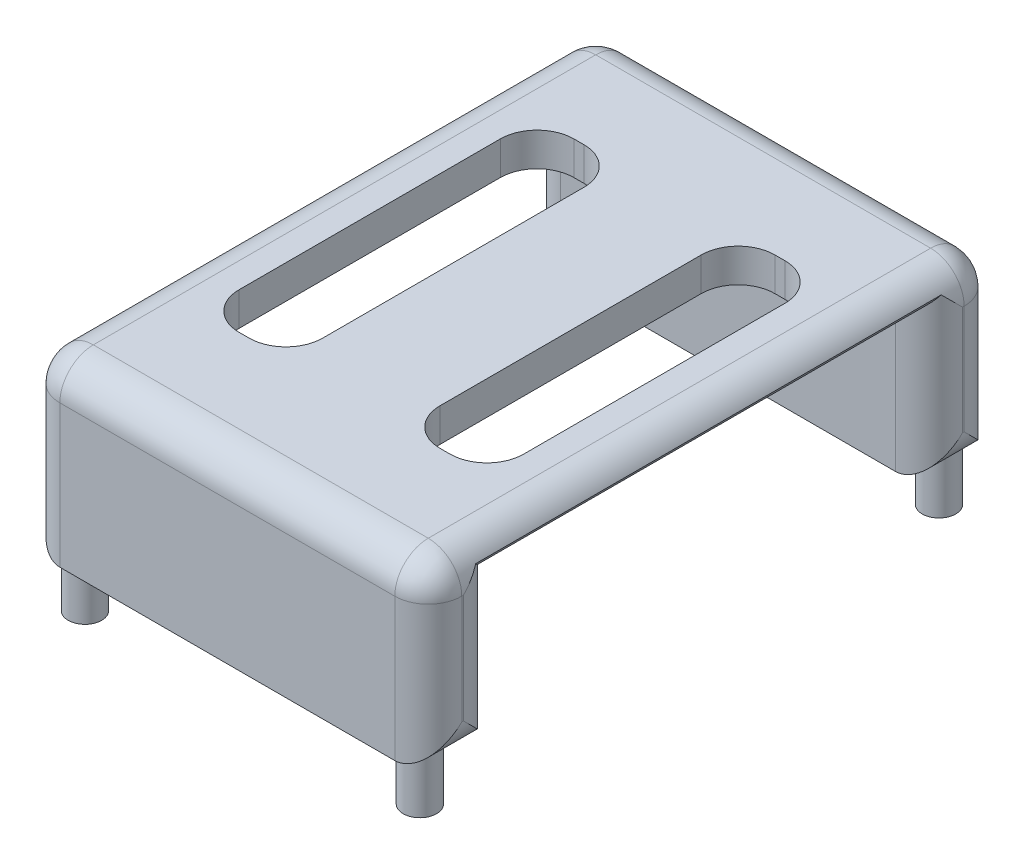
from build123d import *

# Parameters (mm, degrees)
SKETCH_1_W          = 20
SKETCH_1_H          = 2.6
EXTRUDE_1_DEPTH     = 8.5
SKETCH_2_W          = 24
SKETCH_2_H          = 34
EXTRUDE_2_DEPTH     = 2
FILLET_1_R          = 2
SKETCH_3_R          = 1
EXTRUDE_3_DEPTH     = 3
FILLET_2_R          = 2
CUT_EXTRUDE_1_DEPTH = 3


with BuildPart() as part:
    # 草图1 → 凸台-拉伸1 (new body)
    with BuildSketch(Plane(origin=(0, 0, 0), x_dir=(1, 0, 0), z_dir=(0, 1, 0))):
        Polygon((-10, -12.9), (-12, -12.9), (-12, -17), (12, -17), (12, -12.9), (10, -12.9), (10, -15.5), (-10, -15.5), align=None)
        with Locations((0, -14.2)):
            Rectangle(SKETCH_1_W, SKETCH_1_H)
        with Locations((0, 14.2)):
            Rectangle(SKETCH_1_W, SKETCH_1_H)
        Polygon((-12, 17), (-12, 12.9), (-10, 12.9), (-10, 15.5), (10, 15.5), (10, 12.9), (12, 12.9), (12, 17), align=None)
    extrude(amount=EXTRUDE_1_DEPTH)

    # 草图2 → 凸台-拉伸2 (add)
    with BuildSketch(Plane(origin=(0, 8.5, 0), x_dir=(1, 0, 0), z_dir=(0, 1, 0))):
        Rectangle(SKETCH_2_W, SKETCH_2_H)
    extrude(amount=EXTRUDE_2_DEPTH)

    # 圆角1
    fillet_1_edges = [part.edges().sort_by_distance(p)[0] for p in [
        (0, 10.5, -17),
        (0, 10.5, 17),
    ]]
    fillet(fillet_1_edges, radius=FILLET_1_R)

    # 草图3 → 凸台-拉伸3 (add)
    with BuildSketch(Plane(origin=(0, 0, 0), x_dir=(-1, 0, 0), z_dir=(0, -1, 0))):
        with Locations(Location((-10, -15.5, 0), (0, 0, 270))):
            Circle(SKETCH_3_R)
        with Locations(Location((10, -15.5, 0), (0, 0, 270))):
            Circle(SKETCH_3_R)
        with Locations(Location((-10, 15.5, 0), (0, 0, 270))):
            Circle(SKETCH_3_R)
        with Locations(Location((10, 15.5, 0), (0, 0, 270))):
            Circle(SKETCH_3_R)
    extrude(amount=EXTRUDE_3_DEPTH)

    # 圆角2
    # the kernel refuses this fillet: 2 mm, written as the material it takes off along each edge
    with BuildSketch(Plane(origin=(12, 0, -12.9), x_dir=(0, 1, 0), z_dir=(0, 0, -1))) as fillet_2_piece_1_section:
        with BuildLine():
            CenterArc((FILLET_2_R, -FILLET_2_R), FILLET_2_R, 90, 90)
            Line((0, -FILLET_2_R), (-FILLET_2_R * 0.02, -FILLET_2_R))
            Line((-FILLET_2_R * 0.02, -FILLET_2_R), (-FILLET_2_R * 0.02, FILLET_2_R * 0.02))
            Line((-FILLET_2_R * 0.02, FILLET_2_R * 0.02), (FILLET_2_R, FILLET_2_R * 0.02))
            Line((FILLET_2_R, FILLET_2_R * 0.02), (FILLET_2_R, 0))
        make_face()
    fillet_2_piece_1 = extrude(amount=4.1, mode=Mode.PRIVATE)
    fillet_2_piece_1 = fillet_2_piece_1 - Plane(origin=(10, 0.469962564, -15.5), x_dir=(0, 0, 1), z_dir=(0, 1, 0)) * Cylinder(1, 17, mode=Mode.PRIVATE)
    add(fillet_2_piece_1, mode=Mode.SUBTRACT)
    with BuildSketch(Plane(origin=(12, 0, -12.9), x_dir=(0, 0, -1), z_dir=(0, 1, 0)), Plane(origin=(-12, 0, 17), x_dir=(1, 0, 0), z_dir=(0, 1, 0)), Plane(origin=(-12, 0, -12.9), x_dir=(1, 0, 0), z_dir=(0, 1, 0)), Plane(origin=(-12, 8.5, -17), x_dir=(1, 0, 0), z_dir=(0, -1, 0))) as fillet_2_piece_2:
        with BuildLine():
            CenterArc((FILLET_2_R, FILLET_2_R), FILLET_2_R, 180, 90)
            Line((0, FILLET_2_R), (-FILLET_2_R * 0.02, FILLET_2_R))
            Line((-FILLET_2_R * 0.02, FILLET_2_R), (-FILLET_2_R * 0.02, -FILLET_2_R * 0.02))
            Line((-FILLET_2_R * 0.02, -FILLET_2_R * 0.02), (FILLET_2_R, -FILLET_2_R * 0.02))
            Line((FILLET_2_R, -FILLET_2_R * 0.02), (FILLET_2_R, 0))
        make_face()
    extrude(amount=8.5, mode=Mode.SUBTRACT)
    with BuildSketch(Plane(origin=(12, 8.5, -12.9), x_dir=(0, 1, 0), z_dir=(0, 0, 1))) as fillet_2_piece_3:
        with BuildLine():
            CenterArc((FILLET_2_R, FILLET_2_R), FILLET_2_R, 180, 90)
            Line((0, FILLET_2_R), (-FILLET_2_R * 0.02, FILLET_2_R))
            Line((-FILLET_2_R * 0.02, FILLET_2_R), (-FILLET_2_R * 0.02, -FILLET_2_R * 0.02))
            Line((-FILLET_2_R * 0.02, -FILLET_2_R * 0.02), (FILLET_2_R, -FILLET_2_R * 0.02))
            Line((FILLET_2_R, -FILLET_2_R * 0.02), (FILLET_2_R, 0))
        make_face()
    extrude(amount=25.8, mode=Mode.SUBTRACT)
    with BuildSketch(Plane(origin=(12, 0, 12.9), x_dir=(0, 0, 1), z_dir=(0, 1, 0)), Plane(origin=(12, 8.5, 17), x_dir=(0, 0, -1), z_dir=(0, -1, 0)), Plane(origin=(12, 0, -17), x_dir=(0, 0, 1), z_dir=(0, 1, 0)), Plane(origin=(-12, 0, 12.9), x_dir=(1, 0, 0), z_dir=(0, 1, 0))) as fillet_2_piece_4:
        with BuildLine():
            CenterArc((FILLET_2_R, -FILLET_2_R), FILLET_2_R, 90, 90)
            Line((0, -FILLET_2_R), (-FILLET_2_R * 0.02, -FILLET_2_R))
            Line((-FILLET_2_R * 0.02, -FILLET_2_R), (-FILLET_2_R * 0.02, FILLET_2_R * 0.02))
            Line((-FILLET_2_R * 0.02, FILLET_2_R * 0.02), (FILLET_2_R, FILLET_2_R * 0.02))
            Line((FILLET_2_R, FILLET_2_R * 0.02), (FILLET_2_R, 0))
        make_face()
    extrude(amount=8.5, mode=Mode.SUBTRACT)
    with BuildSketch(Plane(origin=(12, 0, 17), x_dir=(0, 1, 0), z_dir=(0, 0, -1))) as fillet_2_piece_5_section:
        with BuildLine():
            CenterArc((FILLET_2_R, -FILLET_2_R), FILLET_2_R, 90, 90)
            Line((0, -FILLET_2_R), (-FILLET_2_R * 0.02, -FILLET_2_R))
            Line((-FILLET_2_R * 0.02, -FILLET_2_R), (-FILLET_2_R * 0.02, FILLET_2_R * 0.02))
            Line((-FILLET_2_R * 0.02, FILLET_2_R * 0.02), (FILLET_2_R, FILLET_2_R * 0.02))
            Line((FILLET_2_R, FILLET_2_R * 0.02), (FILLET_2_R, 0))
        make_face()
    fillet_2_piece_5 = extrude(amount=4.1, mode=Mode.PRIVATE)
    fillet_2_piece_5 = fillet_2_piece_5 - Plane(origin=(10, 0.469962559, 15.5), x_dir=(0, 0, 1), z_dir=(0, 1, 0)) * Cylinder(1, 17, mode=Mode.PRIVATE)
    add(fillet_2_piece_5, mode=Mode.SUBTRACT)
    with BuildSketch(Plane(origin=(12, 8.5, 15), x_dir=(0, 1, 0), z_dir=(0, 0, -1))) as fillet_2_piece_6:
        with BuildLine():
            CenterArc((2 - FILLET_2_R, -FILLET_2_R), FILLET_2_R, 0, 90)
            Line((2, -FILLET_2_R), (2 + FILLET_2_R * 0.02, -FILLET_2_R))
            Line((2 + FILLET_2_R * 0.02, -FILLET_2_R), (2 + FILLET_2_R * 0.02, 0))
            Line((2 + FILLET_2_R * 0.02, 0), (2, FILLET_2_R * 0.02))
            Line((2, FILLET_2_R * 0.02), (2 - FILLET_2_R, FILLET_2_R * 0.02))
            Line((2 - FILLET_2_R, FILLET_2_R * 0.02), (2 - FILLET_2_R, 0))
        make_face()
    revolve(axis=Axis((12, 8.5, 15), (1, 0, 0)), revolution_arc=90, mode=Mode.SUBTRACT)
    with BuildSketch(Plane(origin=(12, 10.5, -15), x_dir=(0, -1, 0), z_dir=(0, 0, 1))) as fillet_2_piece_7:
        with BuildLine():
            CenterArc((FILLET_2_R, -FILLET_2_R), FILLET_2_R, 90, 90)
            Line((0, -FILLET_2_R), (-FILLET_2_R * 0.02, -FILLET_2_R))
            Line((-FILLET_2_R * 0.02, -FILLET_2_R), (-FILLET_2_R * 0.02, FILLET_2_R * 0.02))
            Line((-FILLET_2_R * 0.02, FILLET_2_R * 0.02), (FILLET_2_R, FILLET_2_R * 0.02))
            Line((FILLET_2_R, FILLET_2_R * 0.02), (FILLET_2_R, 0))
        make_face()
    extrude(amount=30, mode=Mode.SUBTRACT)
    with BuildSketch(Plane(origin=(12, 8.5, -15), x_dir=(0, 0, -1), z_dir=(0, -1, 0))) as fillet_2_piece_8:
        with BuildLine():
            CenterArc((2 - FILLET_2_R, -FILLET_2_R), FILLET_2_R, 0, 90)
            Line((2, -FILLET_2_R), (2 + FILLET_2_R * 0.02, -FILLET_2_R))
            Line((2 + FILLET_2_R * 0.02, -FILLET_2_R), (2 + FILLET_2_R * 0.02, 0))
            Line((2 + FILLET_2_R * 0.02, 0), (2, FILLET_2_R * 0.02))
            Line((2, FILLET_2_R * 0.02), (2 - FILLET_2_R, FILLET_2_R * 0.02))
            Line((2 - FILLET_2_R, FILLET_2_R * 0.02), (2 - FILLET_2_R, 0))
        make_face()
    revolve(axis=Axis((12, 8.5, -15), (1, 0, 0)), revolution_arc=90, mode=Mode.SUBTRACT)
    with BuildSketch(Plane(origin=(-12, 8.5, 15), x_dir=(0, 1, 0), z_dir=(0, 0, -1))) as fillet_2_piece_9:
        with BuildLine():
            CenterArc((2 - FILLET_2_R, FILLET_2_R), FILLET_2_R, 270, 90)
            Line((2 - FILLET_2_R, 0), (2 - FILLET_2_R, -FILLET_2_R * 0.02))
            Line((2 - FILLET_2_R, -FILLET_2_R * 0.02), (2, -FILLET_2_R * 0.02))
            Line((2, -FILLET_2_R * 0.02), (2 + FILLET_2_R * 0.02, 0))
            Line((2 + FILLET_2_R * 0.02, 0), (2 + FILLET_2_R * 0.02, FILLET_2_R))
            Line((2 + FILLET_2_R * 0.02, FILLET_2_R), (2, FILLET_2_R))
        make_face()
    revolve(axis=Axis((-12, 8.5, 15), (1, 0, 0)), revolution_arc=90, mode=Mode.SUBTRACT)
    with BuildSketch(Plane(origin=(-12, 0, 12.9), x_dir=(1, 0, 0), z_dir=(0, 0, 1))) as fillet_2_piece_10_section:
        with BuildLine():
            CenterArc((FILLET_2_R, FILLET_2_R), FILLET_2_R, 180, 90)
            Line((0, FILLET_2_R), (-FILLET_2_R * 0.02, FILLET_2_R))
            Line((-FILLET_2_R * 0.02, FILLET_2_R), (-FILLET_2_R * 0.02, -FILLET_2_R * 0.02))
            Line((-FILLET_2_R * 0.02, -FILLET_2_R * 0.02), (FILLET_2_R, -FILLET_2_R * 0.02))
            Line((FILLET_2_R, -FILLET_2_R * 0.02), (FILLET_2_R, 0))
        make_face()
    fillet_2_piece_10 = extrude(amount=4.1, mode=Mode.PRIVATE)
    fillet_2_piece_10 = fillet_2_piece_10 - Plane(origin=(-10, 0.469962848, 15.5), x_dir=(0, 0, 1), z_dir=(0, 1, 0)) * Cylinder(1, 17, mode=Mode.PRIVATE)
    add(fillet_2_piece_10, mode=Mode.SUBTRACT)
    with BuildSketch(Plane(origin=(-12, 8.5, 12.9), x_dir=(1, 0, 0), z_dir=(0, 0, -1))) as fillet_2_piece_11:
        with BuildLine():
            CenterArc((FILLET_2_R, -FILLET_2_R), FILLET_2_R, 90, 90)
            Line((0, -FILLET_2_R), (-FILLET_2_R * 0.02, -FILLET_2_R))
            Line((-FILLET_2_R * 0.02, -FILLET_2_R), (-FILLET_2_R * 0.02, FILLET_2_R * 0.02))
            Line((-FILLET_2_R * 0.02, FILLET_2_R * 0.02), (FILLET_2_R, FILLET_2_R * 0.02))
            Line((FILLET_2_R, FILLET_2_R * 0.02), (FILLET_2_R, 0))
        make_face()
    extrude(amount=25.8, mode=Mode.SUBTRACT)
    with BuildSketch(Plane(origin=(-12, 0, -17), x_dir=(1, 0, 0), z_dir=(0, 0, 1))) as fillet_2_piece_12_section:
        with BuildLine():
            CenterArc((FILLET_2_R, FILLET_2_R), FILLET_2_R, 180, 90)
            Line((0, FILLET_2_R), (-FILLET_2_R * 0.02, FILLET_2_R))
            Line((-FILLET_2_R * 0.02, FILLET_2_R), (-FILLET_2_R * 0.02, -FILLET_2_R * 0.02))
            Line((-FILLET_2_R * 0.02, -FILLET_2_R * 0.02), (FILLET_2_R, -FILLET_2_R * 0.02))
            Line((FILLET_2_R, -FILLET_2_R * 0.02), (FILLET_2_R, 0))
        make_face()
    fillet_2_piece_12 = extrude(amount=4.1, mode=Mode.PRIVATE)
    fillet_2_piece_12 = fillet_2_piece_12 - Plane(origin=(-10, 0.469962842, -15.5), x_dir=(0, 0, 1), z_dir=(0, 1, 0)) * Cylinder(1, 17, mode=Mode.PRIVATE)
    add(fillet_2_piece_12, mode=Mode.SUBTRACT)
    with BuildSketch(Plane(origin=(-12, 8.5, -15), x_dir=(0, 0, -1), z_dir=(0, -1, 0))) as fillet_2_piece_13:
        with BuildLine():
            CenterArc((2 - FILLET_2_R, FILLET_2_R), FILLET_2_R, 270, 90)
            Line((2 - FILLET_2_R, 0), (2 - FILLET_2_R, -FILLET_2_R * 0.02))
            Line((2 - FILLET_2_R, -FILLET_2_R * 0.02), (2, -FILLET_2_R * 0.02))
            Line((2, -FILLET_2_R * 0.02), (2 + FILLET_2_R * 0.02, 0))
            Line((2 + FILLET_2_R * 0.02, 0), (2 + FILLET_2_R * 0.02, FILLET_2_R))
            Line((2 + FILLET_2_R * 0.02, FILLET_2_R), (2, FILLET_2_R))
        make_face()
    revolve(axis=Axis((-12, 8.5, -15), (1, 0, 0)), revolution_arc=90, mode=Mode.SUBTRACT)
    with BuildSketch(Plane(origin=(-12, 10.5, 15), x_dir=(1, 0, 0), z_dir=(0, 0, -1))) as fillet_2_piece_14:
        with BuildLine():
            CenterArc((FILLET_2_R, FILLET_2_R), FILLET_2_R, 180, 90)
            Line((0, FILLET_2_R), (-FILLET_2_R * 0.02, FILLET_2_R))
            Line((-FILLET_2_R * 0.02, FILLET_2_R), (-FILLET_2_R * 0.02, -FILLET_2_R * 0.02))
            Line((-FILLET_2_R * 0.02, -FILLET_2_R * 0.02), (FILLET_2_R, -FILLET_2_R * 0.02))
            Line((FILLET_2_R, -FILLET_2_R * 0.02), (FILLET_2_R, 0))
        make_face()
    extrude(amount=30, mode=Mode.SUBTRACT)
    with BuildSketch(Plane(origin=(12, -5, -12.9), x_dir=(0, 0, -1), z_dir=(0, 1, 0))) as fillet_2_piece_15a_section:
        with BuildLine():
            CenterArc((FILLET_2_R, FILLET_2_R), FILLET_2_R, 180, 90)
            Line((0, FILLET_2_R), (-FILLET_2_R * 0.02, FILLET_2_R))
            Line((-FILLET_2_R * 0.02, FILLET_2_R), (-FILLET_2_R * 0.02, -FILLET_2_R * 0.02))
            Line((-FILLET_2_R * 0.02, -FILLET_2_R * 0.02), (FILLET_2_R, -FILLET_2_R * 0.02))
            Line((FILLET_2_R, -FILLET_2_R * 0.02), (FILLET_2_R, 0))
        make_face()
    fillet_2_piece_15a = extrude(amount=13.5, mode=Mode.PRIVATE)
    fillet_2_piece_15a = split(fillet_2_piece_15a, bisect_by=Plane(origin=(11.547209771, 0, -13.352790229), z_dir=(0, -1, 0)), keep=Keep.TOP, mode=Mode.PRIVATE)
    with BuildSketch(Plane(origin=(12, 0, -7.9), x_dir=(0, 1, 0), z_dir=(0, 0, -1))) as fillet_2_piece_15b_section:
        with BuildLine():
            CenterArc((FILLET_2_R, -FILLET_2_R), FILLET_2_R, 90, 90)
            Line((0, -FILLET_2_R), (-FILLET_2_R * 0.02, -FILLET_2_R))
            Line((-FILLET_2_R * 0.02, -FILLET_2_R), (-FILLET_2_R * 0.02, FILLET_2_R * 0.02))
            Line((-FILLET_2_R * 0.02, FILLET_2_R * 0.02), (FILLET_2_R, FILLET_2_R * 0.02))
            Line((FILLET_2_R, FILLET_2_R * 0.02), (FILLET_2_R, 0))
        make_face()
    fillet_2_piece_15b = extrude(amount=9.1, mode=Mode.PRIVATE)
    fillet_2_piece_15b = split(fillet_2_piece_15b, bisect_by=Plane(origin=(11.547209771, 0.452790229, -12.9), z_dir=(0, 0, 1)), keep=Keep.TOP, mode=Mode.PRIVATE)
    fillet_2_piece_15 = fillet_2_piece_15a & fillet_2_piece_15b
    add(fillet_2_piece_15, mode=Mode.SUBTRACT)
    with BuildSketch(Plane(origin=(12, -5, -17), x_dir=(0, 0, 1), z_dir=(0, 1, 0))) as fillet_2_piece_16a_section:
        with BuildLine():
            CenterArc((FILLET_2_R, -FILLET_2_R), FILLET_2_R, 90, 90)
            Line((0, -FILLET_2_R), (-FILLET_2_R * 0.02, -FILLET_2_R))
            Line((-FILLET_2_R * 0.02, -FILLET_2_R), (-FILLET_2_R * 0.02, FILLET_2_R * 0.02))
            Line((-FILLET_2_R * 0.02, FILLET_2_R * 0.02), (FILLET_2_R, FILLET_2_R * 0.02))
            Line((FILLET_2_R, FILLET_2_R * 0.02), (FILLET_2_R, 0))
        make_face()
    fillet_2_piece_16a = extrude(amount=13.5, mode=Mode.PRIVATE)
    fillet_2_piece_16a = split(fillet_2_piece_16a, bisect_by=Plane(origin=(11.547209771, 0, -16.547209771), z_dir=(0, -1, 0)), keep=Keep.TOP, mode=Mode.PRIVATE)
    with BuildSketch(Plane(origin=(12, 0, -12.9), x_dir=(0, 1, 0), z_dir=(0, 0, -1))) as fillet_2_piece_16b_section:
        with BuildLine():
            CenterArc((FILLET_2_R, -FILLET_2_R), FILLET_2_R, 90, 90)
            Line((0, -FILLET_2_R), (-FILLET_2_R * 0.02, -FILLET_2_R))
            Line((-FILLET_2_R * 0.02, -FILLET_2_R), (-FILLET_2_R * 0.02, FILLET_2_R * 0.02))
            Line((-FILLET_2_R * 0.02, FILLET_2_R * 0.02), (FILLET_2_R, FILLET_2_R * 0.02))
            Line((FILLET_2_R, FILLET_2_R * 0.02), (FILLET_2_R, 0))
        make_face()
    fillet_2_piece_16b = extrude(amount=9.1, mode=Mode.PRIVATE)
    fillet_2_piece_16b = split(fillet_2_piece_16b, bisect_by=Plane(origin=(11.547209771, 0.452790229, -17), z_dir=(0, 0, -1)), keep=Keep.TOP, mode=Mode.PRIVATE)
    fillet_2_piece_16 = fillet_2_piece_16a & fillet_2_piece_16b
    add(fillet_2_piece_16, mode=Mode.SUBTRACT)
    with BuildSketch(Plane(origin=(12, 8.5, -17.9), x_dir=(0, 1, 0), z_dir=(0, 0, 1))) as fillet_2_piece_17a_section:
        with BuildLine():
            CenterArc((FILLET_2_R, FILLET_2_R), FILLET_2_R, 180, 90)
            Line((0, FILLET_2_R), (-FILLET_2_R * 0.02, FILLET_2_R))
            Line((-FILLET_2_R * 0.02, FILLET_2_R), (-FILLET_2_R * 0.02, -FILLET_2_R * 0.02))
            Line((-FILLET_2_R * 0.02, -FILLET_2_R * 0.02), (FILLET_2_R, -FILLET_2_R * 0.02))
            Line((FILLET_2_R, -FILLET_2_R * 0.02), (FILLET_2_R, 0))
        make_face()
    fillet_2_piece_17a = extrude(amount=30.8, mode=Mode.PRIVATE)
    fillet_2_piece_17a = split(fillet_2_piece_17a, bisect_by=Plane(origin=(11.547209771, 8.952790229, -12.9), z_dir=(0, 0, -1)), keep=Keep.TOP, mode=Mode.PRIVATE)
    with BuildSketch(Plane(origin=(12, 0, -12.9), x_dir=(0, 0, -1), z_dir=(0, 1, 0))) as fillet_2_piece_17b_section:
        with BuildLine():
            CenterArc((FILLET_2_R, FILLET_2_R), FILLET_2_R, 180, 90)
            Line((0, FILLET_2_R), (-FILLET_2_R * 0.02, FILLET_2_R))
            Line((-FILLET_2_R * 0.02, FILLET_2_R), (-FILLET_2_R * 0.02, -FILLET_2_R * 0.02))
            Line((-FILLET_2_R * 0.02, -FILLET_2_R * 0.02), (FILLET_2_R, -FILLET_2_R * 0.02))
            Line((FILLET_2_R, -FILLET_2_R * 0.02), (FILLET_2_R, 0))
        make_face()
    fillet_2_piece_17b = extrude(amount=13.5, mode=Mode.PRIVATE)
    fillet_2_piece_17b = split(fillet_2_piece_17b, bisect_by=Plane(origin=(11.547209771, 8.5, -13.352790229), z_dir=(0, 1, 0)), keep=Keep.TOP, mode=Mode.PRIVATE)
    fillet_2_piece_17 = fillet_2_piece_17a & fillet_2_piece_17b
    add(fillet_2_piece_17, mode=Mode.SUBTRACT)
    with BuildSketch(Plane(origin=(12, 0, 12.9), x_dir=(0, 0, 1), z_dir=(0, 1, 0))) as fillet_2_piece_18a_section:
        with BuildLine():
            CenterArc((FILLET_2_R, -FILLET_2_R), FILLET_2_R, 90, 90)
            Line((0, -FILLET_2_R), (-FILLET_2_R * 0.02, -FILLET_2_R))
            Line((-FILLET_2_R * 0.02, -FILLET_2_R), (-FILLET_2_R * 0.02, FILLET_2_R * 0.02))
            Line((-FILLET_2_R * 0.02, FILLET_2_R * 0.02), (FILLET_2_R, FILLET_2_R * 0.02))
            Line((FILLET_2_R, FILLET_2_R * 0.02), (FILLET_2_R, 0))
        make_face()
    fillet_2_piece_18a = extrude(amount=13.5, mode=Mode.PRIVATE)
    fillet_2_piece_18a = split(fillet_2_piece_18a, bisect_by=Plane(origin=(11.547209771, 8.5, 13.352790229), z_dir=(0, 1, 0)), keep=Keep.TOP, mode=Mode.PRIVATE)
    with BuildSketch(Plane(origin=(12, 8.5, -12.9), x_dir=(0, 1, 0), z_dir=(0, 0, 1))) as fillet_2_piece_18b_section:
        with BuildLine():
            CenterArc((FILLET_2_R, FILLET_2_R), FILLET_2_R, 180, 90)
            Line((0, FILLET_2_R), (-FILLET_2_R * 0.02, FILLET_2_R))
            Line((-FILLET_2_R * 0.02, FILLET_2_R), (-FILLET_2_R * 0.02, -FILLET_2_R * 0.02))
            Line((-FILLET_2_R * 0.02, -FILLET_2_R * 0.02), (FILLET_2_R, -FILLET_2_R * 0.02))
            Line((FILLET_2_R, -FILLET_2_R * 0.02), (FILLET_2_R, 0))
        make_face()
    fillet_2_piece_18b = extrude(amount=30.8, mode=Mode.PRIVATE)
    fillet_2_piece_18b = split(fillet_2_piece_18b, bisect_by=Plane(origin=(11.547209771, 8.952790229, 12.9), z_dir=(0, 0, 1)), keep=Keep.TOP, mode=Mode.PRIVATE)
    fillet_2_piece_18 = fillet_2_piece_18a & fillet_2_piece_18b
    add(fillet_2_piece_18, mode=Mode.SUBTRACT)
    with BuildSketch(Plane(origin=(12, 0, 17), x_dir=(0, 1, 0), z_dir=(0, 0, -1))) as fillet_2_piece_19a_section:
        with BuildLine():
            CenterArc((FILLET_2_R, -FILLET_2_R), FILLET_2_R, 90, 90)
            Line((0, -FILLET_2_R), (-FILLET_2_R * 0.02, -FILLET_2_R))
            Line((-FILLET_2_R * 0.02, -FILLET_2_R), (-FILLET_2_R * 0.02, FILLET_2_R * 0.02))
            Line((-FILLET_2_R * 0.02, FILLET_2_R * 0.02), (FILLET_2_R, FILLET_2_R * 0.02))
            Line((FILLET_2_R, FILLET_2_R * 0.02), (FILLET_2_R, 0))
        make_face()
    fillet_2_piece_19a = extrude(amount=9.1, mode=Mode.PRIVATE)
    fillet_2_piece_19a = split(fillet_2_piece_19a, bisect_by=Plane(origin=(11.547209771, 0.452790229, 12.9), z_dir=(0, 0, -1)), keep=Keep.TOP, mode=Mode.PRIVATE)
    with BuildSketch(Plane(origin=(12, -5, 12.9), x_dir=(0, 0, 1), z_dir=(0, 1, 0))) as fillet_2_piece_19b_section:
        with BuildLine():
            CenterArc((FILLET_2_R, -FILLET_2_R), FILLET_2_R, 90, 90)
            Line((0, -FILLET_2_R), (-FILLET_2_R * 0.02, -FILLET_2_R))
            Line((-FILLET_2_R * 0.02, -FILLET_2_R), (-FILLET_2_R * 0.02, FILLET_2_R * 0.02))
            Line((-FILLET_2_R * 0.02, FILLET_2_R * 0.02), (FILLET_2_R, FILLET_2_R * 0.02))
            Line((FILLET_2_R, FILLET_2_R * 0.02), (FILLET_2_R, 0))
        make_face()
    fillet_2_piece_19b = extrude(amount=13.5, mode=Mode.PRIVATE)
    fillet_2_piece_19b = split(fillet_2_piece_19b, bisect_by=Plane(origin=(11.547209771, 0, 13.352790229), z_dir=(0, -1, 0)), keep=Keep.TOP, mode=Mode.PRIVATE)
    fillet_2_piece_19 = fillet_2_piece_19a & fillet_2_piece_19b
    add(fillet_2_piece_19, mode=Mode.SUBTRACT)
    with BuildSketch(Plane(origin=(12, 8.5, 17), x_dir=(0, 0, -1), z_dir=(0, -1, 0))) as fillet_2_piece_20a_section:
        with BuildLine():
            CenterArc((FILLET_2_R, -FILLET_2_R), FILLET_2_R, 90, 90)
            Line((0, -FILLET_2_R), (-FILLET_2_R * 0.02, -FILLET_2_R))
            Line((-FILLET_2_R * 0.02, -FILLET_2_R), (-FILLET_2_R * 0.02, FILLET_2_R * 0.02))
            Line((-FILLET_2_R * 0.02, FILLET_2_R * 0.02), (FILLET_2_R, FILLET_2_R * 0.02))
            Line((FILLET_2_R, FILLET_2_R * 0.02), (FILLET_2_R, 0))
        make_face()
    fillet_2_piece_20a = extrude(amount=13.5, mode=Mode.PRIVATE)
    fillet_2_piece_20a = split(fillet_2_piece_20a, bisect_by=Plane(origin=(11.547209771, 0, 16.547209771), z_dir=(0, -1, 0)), keep=Keep.TOP, mode=Mode.PRIVATE)
    with BuildSketch(Plane(origin=(12, 0, 22), x_dir=(0, 1, 0), z_dir=(0, 0, -1))) as fillet_2_piece_20b_section:
        with BuildLine():
            CenterArc((FILLET_2_R, -FILLET_2_R), FILLET_2_R, 90, 90)
            Line((0, -FILLET_2_R), (-FILLET_2_R * 0.02, -FILLET_2_R))
            Line((-FILLET_2_R * 0.02, -FILLET_2_R), (-FILLET_2_R * 0.02, FILLET_2_R * 0.02))
            Line((-FILLET_2_R * 0.02, FILLET_2_R * 0.02), (FILLET_2_R, FILLET_2_R * 0.02))
            Line((FILLET_2_R, FILLET_2_R * 0.02), (FILLET_2_R, 0))
        make_face()
    fillet_2_piece_20b = extrude(amount=9.1, mode=Mode.PRIVATE)
    fillet_2_piece_20b = split(fillet_2_piece_20b, bisect_by=Plane(origin=(11.547209771, 0.452790229, 17), z_dir=(0, 0, 1)), keep=Keep.TOP, mode=Mode.PRIVATE)
    fillet_2_piece_20 = fillet_2_piece_20a & fillet_2_piece_20b
    add(fillet_2_piece_20, mode=Mode.SUBTRACT)
    with BuildSketch(Plane(origin=(-12, -5, 17), x_dir=(1, 0, 0), z_dir=(0, 1, 0))) as fillet_2_piece_21a_section:
        with BuildLine():
            CenterArc((FILLET_2_R, FILLET_2_R), FILLET_2_R, 180, 90)
            Line((0, FILLET_2_R), (-FILLET_2_R * 0.02, FILLET_2_R))
            Line((-FILLET_2_R * 0.02, FILLET_2_R), (-FILLET_2_R * 0.02, -FILLET_2_R * 0.02))
            Line((-FILLET_2_R * 0.02, -FILLET_2_R * 0.02), (FILLET_2_R, -FILLET_2_R * 0.02))
            Line((FILLET_2_R, -FILLET_2_R * 0.02), (FILLET_2_R, 0))
        make_face()
    fillet_2_piece_21a = extrude(amount=13.5, mode=Mode.PRIVATE)
    fillet_2_piece_21a = split(fillet_2_piece_21a, bisect_by=Plane(origin=(-11.547209771, 0, 16.547209771), z_dir=(0, -1, 0)), keep=Keep.TOP, mode=Mode.PRIVATE)
    with BuildSketch(Plane(origin=(-12, 0, 12.9), x_dir=(1, 0, 0), z_dir=(0, 0, 1))) as fillet_2_piece_21b_section:
        with BuildLine():
            CenterArc((FILLET_2_R, FILLET_2_R), FILLET_2_R, 180, 90)
            Line((0, FILLET_2_R), (-FILLET_2_R * 0.02, FILLET_2_R))
            Line((-FILLET_2_R * 0.02, FILLET_2_R), (-FILLET_2_R * 0.02, -FILLET_2_R * 0.02))
            Line((-FILLET_2_R * 0.02, -FILLET_2_R * 0.02), (FILLET_2_R, -FILLET_2_R * 0.02))
            Line((FILLET_2_R, -FILLET_2_R * 0.02), (FILLET_2_R, 0))
        make_face()
    fillet_2_piece_21b = extrude(amount=9.1, mode=Mode.PRIVATE)
    fillet_2_piece_21b = split(fillet_2_piece_21b, bisect_by=Plane(origin=(-11.547209771, 0.452790229, 17), z_dir=(0, 0, 1)), keep=Keep.TOP, mode=Mode.PRIVATE)
    fillet_2_piece_21 = fillet_2_piece_21a & fillet_2_piece_21b
    add(fillet_2_piece_21, mode=Mode.SUBTRACT)
    with BuildSketch(Plane(origin=(-12, 0, 7.9), x_dir=(1, 0, 0), z_dir=(0, 0, 1))) as fillet_2_piece_22a_section:
        with BuildLine():
            CenterArc((FILLET_2_R, FILLET_2_R), FILLET_2_R, 180, 90)
            Line((0, FILLET_2_R), (-FILLET_2_R * 0.02, FILLET_2_R))
            Line((-FILLET_2_R * 0.02, FILLET_2_R), (-FILLET_2_R * 0.02, -FILLET_2_R * 0.02))
            Line((-FILLET_2_R * 0.02, -FILLET_2_R * 0.02), (FILLET_2_R, -FILLET_2_R * 0.02))
            Line((FILLET_2_R, -FILLET_2_R * 0.02), (FILLET_2_R, 0))
        make_face()
    fillet_2_piece_22a = extrude(amount=9.1, mode=Mode.PRIVATE)
    fillet_2_piece_22a = split(fillet_2_piece_22a, bisect_by=Plane(origin=(-11.547209771, 0.452790229, 12.9), z_dir=(0, 0, -1)), keep=Keep.TOP, mode=Mode.PRIVATE)
    with BuildSketch(Plane(origin=(-12, -5, 12.9), x_dir=(1, 0, 0), z_dir=(0, 1, 0))) as fillet_2_piece_22b_section:
        with BuildLine():
            CenterArc((FILLET_2_R, -FILLET_2_R), FILLET_2_R, 90, 90)
            Line((0, -FILLET_2_R), (-FILLET_2_R * 0.02, -FILLET_2_R))
            Line((-FILLET_2_R * 0.02, -FILLET_2_R), (-FILLET_2_R * 0.02, FILLET_2_R * 0.02))
            Line((-FILLET_2_R * 0.02, FILLET_2_R * 0.02), (FILLET_2_R, FILLET_2_R * 0.02))
            Line((FILLET_2_R, FILLET_2_R * 0.02), (FILLET_2_R, 0))
        make_face()
    fillet_2_piece_22b = extrude(amount=13.5, mode=Mode.PRIVATE)
    fillet_2_piece_22b = split(fillet_2_piece_22b, bisect_by=Plane(origin=(-11.547209771, 0, 13.352790229), z_dir=(0, -1, 0)), keep=Keep.TOP, mode=Mode.PRIVATE)
    fillet_2_piece_22 = fillet_2_piece_22a & fillet_2_piece_22b
    add(fillet_2_piece_22, mode=Mode.SUBTRACT)
    with BuildSketch(Plane(origin=(-12, 0, 12.9), x_dir=(1, 0, 0), z_dir=(0, 1, 0))) as fillet_2_piece_23a_section:
        with BuildLine():
            CenterArc((FILLET_2_R, -FILLET_2_R), FILLET_2_R, 90, 90)
            Line((0, -FILLET_2_R), (-FILLET_2_R * 0.02, -FILLET_2_R))
            Line((-FILLET_2_R * 0.02, -FILLET_2_R), (-FILLET_2_R * 0.02, FILLET_2_R * 0.02))
            Line((-FILLET_2_R * 0.02, FILLET_2_R * 0.02), (FILLET_2_R, FILLET_2_R * 0.02))
            Line((FILLET_2_R, FILLET_2_R * 0.02), (FILLET_2_R, 0))
        make_face()
    fillet_2_piece_23a = extrude(amount=13.5, mode=Mode.PRIVATE)
    fillet_2_piece_23a = split(fillet_2_piece_23a, bisect_by=Plane(origin=(-11.547209771, 8.5, 13.352790229), z_dir=(0, 1, 0)), keep=Keep.TOP, mode=Mode.PRIVATE)
    with BuildSketch(Plane(origin=(-12, 8.5, 17.9), x_dir=(1, 0, 0), z_dir=(0, 0, -1))) as fillet_2_piece_23b_section:
        with BuildLine():
            CenterArc((FILLET_2_R, -FILLET_2_R), FILLET_2_R, 90, 90)
            Line((0, -FILLET_2_R), (-FILLET_2_R * 0.02, -FILLET_2_R))
            Line((-FILLET_2_R * 0.02, -FILLET_2_R), (-FILLET_2_R * 0.02, FILLET_2_R * 0.02))
            Line((-FILLET_2_R * 0.02, FILLET_2_R * 0.02), (FILLET_2_R, FILLET_2_R * 0.02))
            Line((FILLET_2_R, FILLET_2_R * 0.02), (FILLET_2_R, 0))
        make_face()
    fillet_2_piece_23b = extrude(amount=30.8, mode=Mode.PRIVATE)
    fillet_2_piece_23b = split(fillet_2_piece_23b, bisect_by=Plane(origin=(-11.547209771, 8.952790229, 12.9), z_dir=(0, 0, 1)), keep=Keep.TOP, mode=Mode.PRIVATE)
    fillet_2_piece_23 = fillet_2_piece_23a & fillet_2_piece_23b
    add(fillet_2_piece_23, mode=Mode.SUBTRACT)
    with BuildSketch(Plane(origin=(-12, 8.5, 12.9), x_dir=(1, 0, 0), z_dir=(0, 0, -1))) as fillet_2_piece_24a_section:
        with BuildLine():
            CenterArc((FILLET_2_R, -FILLET_2_R), FILLET_2_R, 90, 90)
            Line((0, -FILLET_2_R), (-FILLET_2_R * 0.02, -FILLET_2_R))
            Line((-FILLET_2_R * 0.02, -FILLET_2_R), (-FILLET_2_R * 0.02, FILLET_2_R * 0.02))
            Line((-FILLET_2_R * 0.02, FILLET_2_R * 0.02), (FILLET_2_R, FILLET_2_R * 0.02))
            Line((FILLET_2_R, FILLET_2_R * 0.02), (FILLET_2_R, 0))
        make_face()
    fillet_2_piece_24a = extrude(amount=30.8, mode=Mode.PRIVATE)
    fillet_2_piece_24a = split(fillet_2_piece_24a, bisect_by=Plane(origin=(-11.547209771, 8.952790229, -12.9), z_dir=(0, 0, -1)), keep=Keep.TOP, mode=Mode.PRIVATE)
    with BuildSketch(Plane(origin=(-12, 0, -12.9), x_dir=(1, 0, 0), z_dir=(0, 1, 0))) as fillet_2_piece_24b_section:
        with BuildLine():
            CenterArc((FILLET_2_R, FILLET_2_R), FILLET_2_R, 180, 90)
            Line((0, FILLET_2_R), (-FILLET_2_R * 0.02, FILLET_2_R))
            Line((-FILLET_2_R * 0.02, FILLET_2_R), (-FILLET_2_R * 0.02, -FILLET_2_R * 0.02))
            Line((-FILLET_2_R * 0.02, -FILLET_2_R * 0.02), (FILLET_2_R, -FILLET_2_R * 0.02))
            Line((FILLET_2_R, -FILLET_2_R * 0.02), (FILLET_2_R, 0))
        make_face()
    fillet_2_piece_24b = extrude(amount=13.5, mode=Mode.PRIVATE)
    fillet_2_piece_24b = split(fillet_2_piece_24b, bisect_by=Plane(origin=(-11.547209771, 8.5, -13.352790229), z_dir=(0, 1, 0)), keep=Keep.TOP, mode=Mode.PRIVATE)
    fillet_2_piece_24 = fillet_2_piece_24a & fillet_2_piece_24b
    add(fillet_2_piece_24, mode=Mode.SUBTRACT)
    with BuildSketch(Plane(origin=(-12, -5, -12.9), x_dir=(1, 0, 0), z_dir=(0, 1, 0))) as fillet_2_piece_25a_section:
        with BuildLine():
            CenterArc((FILLET_2_R, FILLET_2_R), FILLET_2_R, 180, 90)
            Line((0, FILLET_2_R), (-FILLET_2_R * 0.02, FILLET_2_R))
            Line((-FILLET_2_R * 0.02, FILLET_2_R), (-FILLET_2_R * 0.02, -FILLET_2_R * 0.02))
            Line((-FILLET_2_R * 0.02, -FILLET_2_R * 0.02), (FILLET_2_R, -FILLET_2_R * 0.02))
            Line((FILLET_2_R, -FILLET_2_R * 0.02), (FILLET_2_R, 0))
        make_face()
    fillet_2_piece_25a = extrude(amount=13.5, mode=Mode.PRIVATE)
    fillet_2_piece_25a = split(fillet_2_piece_25a, bisect_by=Plane(origin=(-11.547209771, 0, -13.352790229), z_dir=(0, -1, 0)), keep=Keep.TOP, mode=Mode.PRIVATE)
    with BuildSketch(Plane(origin=(-12, 0, -17), x_dir=(1, 0, 0), z_dir=(0, 0, 1))) as fillet_2_piece_25b_section:
        with BuildLine():
            CenterArc((FILLET_2_R, FILLET_2_R), FILLET_2_R, 180, 90)
            Line((0, FILLET_2_R), (-FILLET_2_R * 0.02, FILLET_2_R))
            Line((-FILLET_2_R * 0.02, FILLET_2_R), (-FILLET_2_R * 0.02, -FILLET_2_R * 0.02))
            Line((-FILLET_2_R * 0.02, -FILLET_2_R * 0.02), (FILLET_2_R, -FILLET_2_R * 0.02))
            Line((FILLET_2_R, -FILLET_2_R * 0.02), (FILLET_2_R, 0))
        make_face()
    fillet_2_piece_25b = extrude(amount=9.1, mode=Mode.PRIVATE)
    fillet_2_piece_25b = split(fillet_2_piece_25b, bisect_by=Plane(origin=(-11.547209771, 0.452790229, -12.9), z_dir=(0, 0, 1)), keep=Keep.TOP, mode=Mode.PRIVATE)
    fillet_2_piece_25 = fillet_2_piece_25a & fillet_2_piece_25b
    add(fillet_2_piece_25, mode=Mode.SUBTRACT)
    with BuildSketch(Plane(origin=(-12, 8.5, -17), x_dir=(1, 0, 0), z_dir=(0, -1, 0))) as fillet_2_piece_26a_section:
        with BuildLine():
            CenterArc((FILLET_2_R, FILLET_2_R), FILLET_2_R, 180, 90)
            Line((0, FILLET_2_R), (-FILLET_2_R * 0.02, FILLET_2_R))
            Line((-FILLET_2_R * 0.02, FILLET_2_R), (-FILLET_2_R * 0.02, -FILLET_2_R * 0.02))
            Line((-FILLET_2_R * 0.02, -FILLET_2_R * 0.02), (FILLET_2_R, -FILLET_2_R * 0.02))
            Line((FILLET_2_R, -FILLET_2_R * 0.02), (FILLET_2_R, 0))
        make_face()
    fillet_2_piece_26a = extrude(amount=13.5, mode=Mode.PRIVATE)
    fillet_2_piece_26a = split(fillet_2_piece_26a, bisect_by=Plane(origin=(-11.547209771, 0, -16.547209771), z_dir=(0, -1, 0)), keep=Keep.TOP, mode=Mode.PRIVATE)
    with BuildSketch(Plane(origin=(-12, 0, -22), x_dir=(1, 0, 0), z_dir=(0, 0, 1))) as fillet_2_piece_26b_section:
        with BuildLine():
            CenterArc((FILLET_2_R, FILLET_2_R), FILLET_2_R, 180, 90)
            Line((0, FILLET_2_R), (-FILLET_2_R * 0.02, FILLET_2_R))
            Line((-FILLET_2_R * 0.02, FILLET_2_R), (-FILLET_2_R * 0.02, -FILLET_2_R * 0.02))
            Line((-FILLET_2_R * 0.02, -FILLET_2_R * 0.02), (FILLET_2_R, -FILLET_2_R * 0.02))
            Line((FILLET_2_R, -FILLET_2_R * 0.02), (FILLET_2_R, 0))
        make_face()
    fillet_2_piece_26b = extrude(amount=9.1, mode=Mode.PRIVATE)
    fillet_2_piece_26b = split(fillet_2_piece_26b, bisect_by=Plane(origin=(-11.547209771, 0.452790229, -17), z_dir=(0, 0, -1)), keep=Keep.TOP, mode=Mode.PRIVATE)
    fillet_2_piece_26 = fillet_2_piece_26a & fillet_2_piece_26b
    add(fillet_2_piece_26, mode=Mode.SUBTRACT)

    # 草图4 → 切除-拉伸1 (cut)
    with BuildSketch(Plane(origin=(0, 10.5, 0), x_dir=(1, 0, 0), z_dir=(0, 1, 0))):
        with BuildLine():
            Line((5.7, 10), (6.3, 10))
            ThreePointArc((6.3, 10), (7.855634919, 9.355634919), (8.5, 7.8))
            Line((8.5, 7.8), (8.5, -7.8))
            ThreePointArc((8.5, -7.8), (7.855634919, -9.355634919), (6.3, -10))
            Line((6.3, -10), (5.7, -10))
            ThreePointArc((5.7, -10), (4.144365081, -9.355634919), (3.5, -7.8))
            Line((3.5, -7.8), (3.5, 7.8))
            ThreePointArc((3.5, 7.8), (4.144365081, 9.355634919), (5.7, 10))
        make_face()
        with BuildLine():
            Line((-6.3, 10), (-5.7, 10))
            ThreePointArc((-5.7, 10), (-4.144365081, 9.355634919), (-3.5, 7.8))
            Line((-3.5, 7.8), (-3.5, -7.8))
            ThreePointArc((-3.5, -7.8), (-4.144365081, -9.355634919), (-5.7, -10))
            Line((-5.7, -10), (-6.3, -10))
            ThreePointArc((-6.3, -10), (-7.855634919, -9.355634919), (-8.5, -7.8))
            Line((-8.5, -7.8), (-8.5, 7.8))
            ThreePointArc((-8.5, 7.8), (-7.855634919, 9.355634919), (-6.3, 10))
        make_face()
    extrude(amount=-CUT_EXTRUDE_1_DEPTH, mode=Mode.SUBTRACT)


solid = part.part
